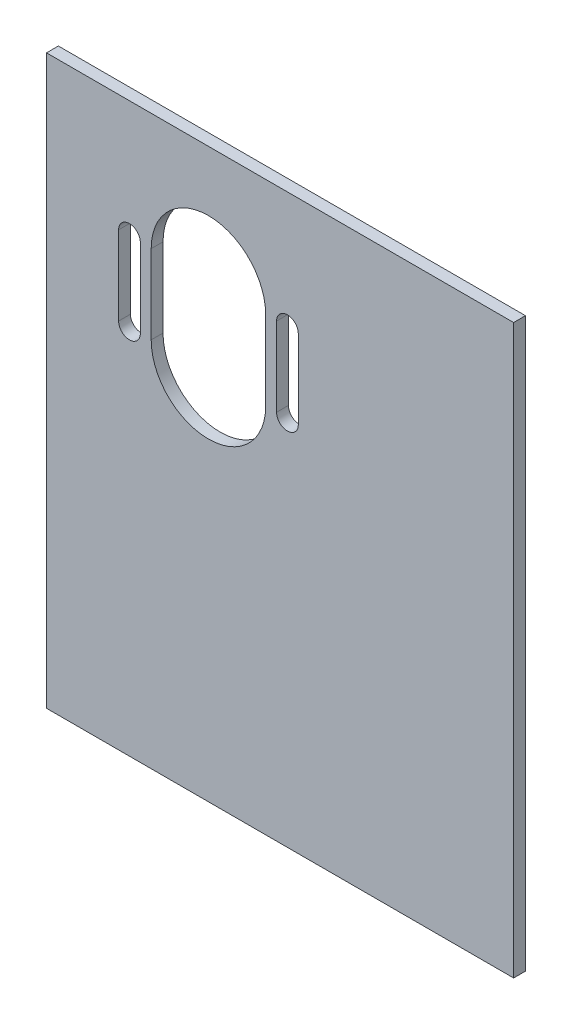
from build123d import *

# Parameters (mm, degrees)
SKETCH1_W           = 118.275
SKETCH1_H           = 143.74
BOSS_EXTRUDE1_DEPTH = 3
CUT_EXTRUDE1_DEPTH  = 3


with BuildPart() as part:
    # Sketch1 → Boss-Extrude1 (new body)
    with BuildSketch(Plane.XY):
        with Locations((59.1375, 71.87)):
            Rectangle(SKETCH1_W, SKETCH1_H)
    extrude(amount=BOSS_EXTRUDE1_DEPTH)

    # Sketch2 → Cut-Extrude1 (cut)
    with BuildSketch(Plane.XY.offset(3)):
        with BuildLine():
            Line((55.5, 114.05), (55.5, 94.05))
            ThreePointArc((55.5, 94.05), (41, 79.55), (26.5, 94.05))
            Line((26.5, 94.05), (26.5, 114.05))
            ThreePointArc((26.5, 114.05), (41, 128.55), (55.5, 114.05))
        make_face()
        with BuildLine():
            Line((63.75, 114.05), (63.75, 94.05))
            ThreePointArc((63.75, 94.05), (61, 91.3), (58.25, 94.05))
            Line((58.25, 94.05), (58.25, 114.05))
            ThreePointArc((58.25, 114.05), (61, 116.8), (63.75, 114.05))
        make_face()
        with BuildLine():
            Line((23.75, 114.05), (23.75, 94.05))
            ThreePointArc((23.75, 94.05), (21, 91.3), (18.25, 94.05))
            Line((18.25, 94.05), (18.25, 114.05))
            ThreePointArc((18.25, 114.05), (21, 116.8), (23.75, 114.05))
        make_face()
    extrude(amount=-CUT_EXTRUDE1_DEPTH, mode=Mode.SUBTRACT)


solid = part.part
